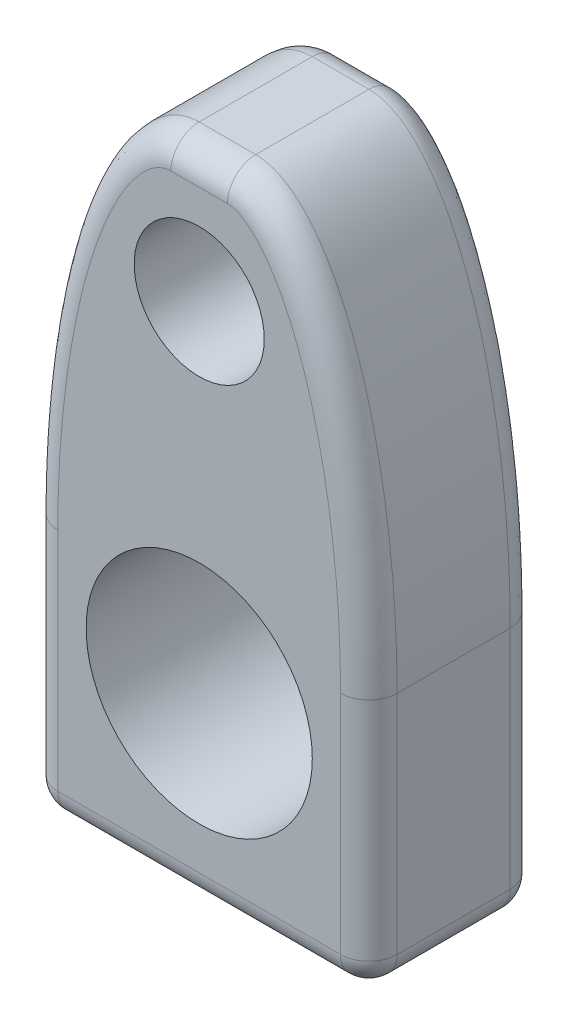
from build123d import *

# Parameters (mm, degrees)
SKETCH1_W            = 12
SKETCH1_H            = 23
BOSS_EXTRUDE1_DEPTH  = 6
SKETCH2_R            = 2.3
SKETCH2_R_2          = 4
CUT_EXTRUDE1_DEPTH   = 6
TAPER_FILLET_SIZE    = 14
TAPER_FILLET_SIZE_2  = 5
TAPER_FILLET2_SIZE   = 14
TAPER_FILLET2_SIZE_2 = 5
EDGE_FILLETS_R       = 1


with BuildPart() as part:
    # Sketch1 → Boss-Extrude1 (new body)
    with BuildSketch(Plane.XY):
        with Locations((6, 11.5)):
            Rectangle(SKETCH1_W, SKETCH1_H)
    extrude(amount=BOSS_EXTRUDE1_DEPTH)

    # Sketch2 → Cut-Extrude1 (cut)
    with BuildSketch(Plane.XY.offset(6)):
        with Locations((6, 18.5)):
            Circle(SKETCH2_R)
        with Locations((6, 6.5)):
            Circle(SKETCH2_R_2)
    extrude(amount=-CUT_EXTRUDE1_DEPTH, mode=Mode.SUBTRACT)

    # taper_fillet
    # an asymmetric fillet: 14, 5 mm, written as the material it takes off along each edge
    with BuildSketch(Plane(origin=(0, 23, -35), x_dir=(0, -1, 0), z_dir=(0, 0, 1))) as taper_fillet_piece_1:
        with BuildLine():
            Bezier((TAPER_FILLET_SIZE, 0), (0, 0), (0, TAPER_FILLET_SIZE_2), weights=[1, 0.707106781, 1])
            Line((0, TAPER_FILLET_SIZE_2), (0, 0))
            Line((0, 0), (TAPER_FILLET_SIZE, 0))
        make_face()
    extrude(amount=76, mode=Mode.SUBTRACT)

    # taper_fillet2
    # an asymmetric fillet: 14, 5 mm, written as the material it takes off along each edge
    with BuildSketch(Plane(origin=(12, 23, -35), x_dir=(0, -1, 0), z_dir=(0, 0, 1))) as taper_fillet2_piece_1:
        with BuildLine():
            Bezier((TAPER_FILLET2_SIZE, 0), (0, 0), (0, -TAPER_FILLET2_SIZE_2), weights=[1, 0.707106781, 1])
            Line((0, -TAPER_FILLET2_SIZE_2), (0, 0))
            Line((0, 0), (TAPER_FILLET2_SIZE, 0))
        make_face()
    extrude(amount=76, mode=Mode.SUBTRACT)

    # edge_fillets
    edge_fillets_edges = [part.edges().sort_by_distance(p)[0] for p in [
        (0, 4.5, 0),
        (0.853211897, 16.822053684, 0),
        (6, 23, 0),
        (12, 4.5, 0),
        (12, 4.5, 6),
        (0, 4.5, 6),
        (0.853211897, 16.822053684, 6),
        (6, 23, 6),
        (0, 0, 3),
        (6, 0, 6),
        (12, 0, 3),
        (6, 0, 0),
        (11.146788103, 16.822053684, 0),
        (11.146788103, 16.822053684, 6),
    ]]
    fillet(edge_fillets_edges, radius=EDGE_FILLETS_R)


solid = part.part
